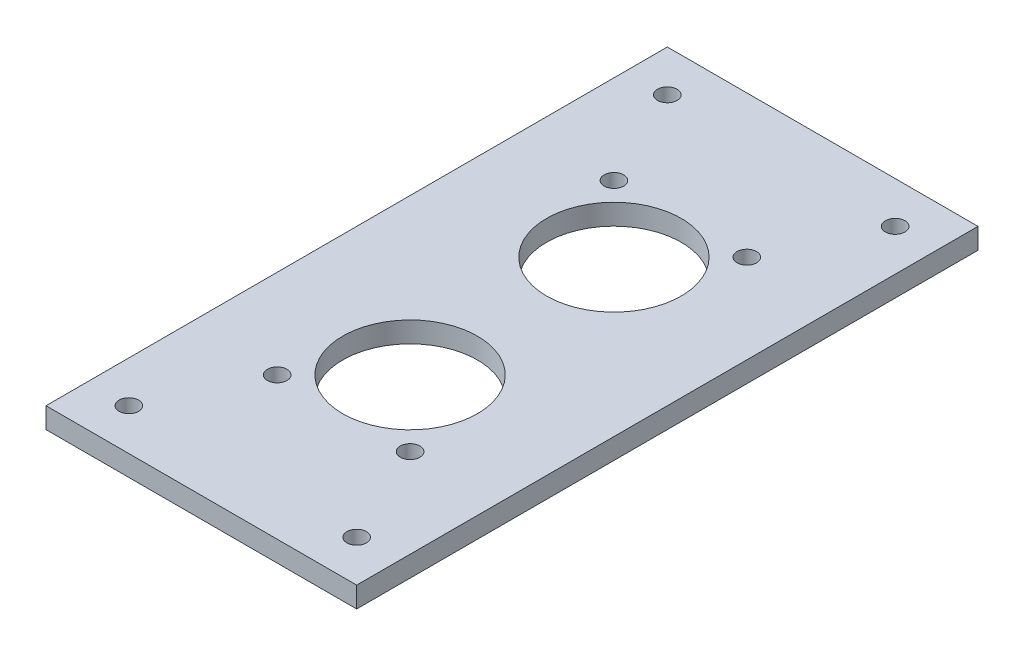
from build123d import *

# Parameters (mm, degrees)
SKETCH1_W                  = 38.1
SKETCH1_H                  = 76.2
BOSS_EXTRUDE1_DEPTH        = 2.54
F_97_0_65_DIAMETER_HOLE1_D = 16.51
M2_CLEARANCE_HOLE2_D       = 2.4
M2_CLEARANCE_HOLE4_D       = 2.4


with BuildPart() as part:
    # Sketch1 → Boss-Extrude1 (new body)
    with BuildSketch(Plane(origin=(0, 0, 0), x_dir=(1, 0, 0), z_dir=(0, 1, 0))):
        Rectangle(SKETCH1_W, SKETCH1_H)
    extrude(amount=BOSS_EXTRUDE1_DEPTH)

    # #97 (0.65) Diameter Hole1 (through all)
    with Locations(Plane(origin=(0, 2.54, 0), x_dir=(1, 0, 0), z_dir=(0, 1, 0))):
        with Locations((0, -12.50061), (0, 12.50061)):
            Hole(F_97_0_65_DIAMETER_HOLE1_D / 2)

    # M2 Clearance Hole2 (through all)
    with Locations(Plane(origin=(0, 2.54, 0), x_dir=(1, 0, 0), z_dir=(0, 1, 0))):
        with Locations((8.14959, 20.6502), (8.14959, -20.6502), (-8.14959, -20.6502), (-8.14959, 20.6502)):
            Hole(M2_CLEARANCE_HOLE2_D / 2)

    # M2 Clearance Hole4 (through all)
    with Locations(Plane(origin=(0, 2.54, 0), x_dir=(1, 0, 0), z_dir=(0, 1, 0))):
        with Locations((-13.97, 33.02), (13.97, 33.02), (-13.97, -33.02), (13.97, -33.02)):
            Hole(M2_CLEARANCE_HOLE4_D / 2)


solid = part.part
